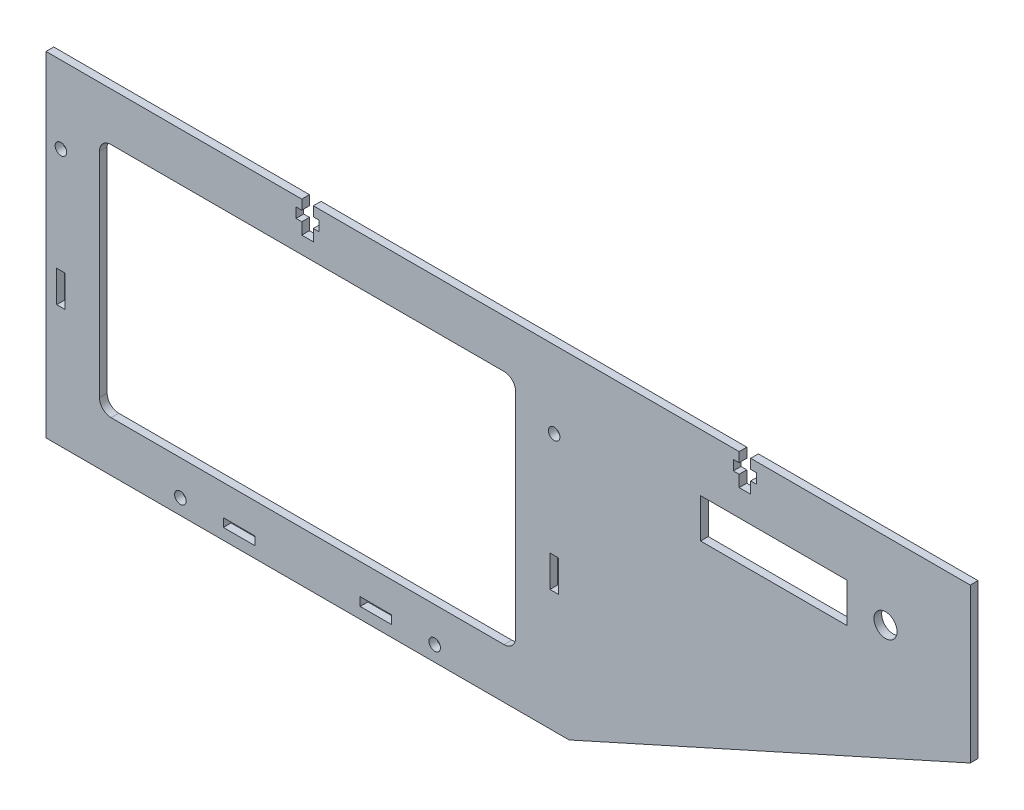
from build123d import *

# Parameters (mm, degrees)
SKETCH_1_R      = 1.5
SKETCH_1_R_2    = 3
SKETCH_1_W      = 8.2
SKETCH_1_H      = 2.2
SKETCH_1_W_2    = 2.2
SKETCH_1_H_2    = 8.2
EXTRUDE_1_DEPTH = 2


with BuildPart() as part:
    # 草图1 → 凸台-拉伸1 (new body)
    with BuildSketch(Plane.XY):
        Polygon((-52.184883937, -13.095981945), (-18.934883937, -13.095981945), (18.565116063, -13.095981945), (67.695116063, -13.095981945), (171.815116063, 33.779018055), (171.815116063, 73.779018055), (114.815116063, 73.779018055), (114.815116063, 71.279018055), (116.315116063, 71.279018055), (116.315116063, 68.679018055), (114.815116063, 68.679018055), (114.815116063, 65.679018055), (111.815116063, 65.679018055), (111.815116063, 68.679018055), (110.315116063, 68.679018055), (110.315116063, 71.279018055), (111.815116063, 71.279018055), (111.815116063, 73.779018055), (1.315116063, 73.779018055), (1.315116063, 71.279018055), (2.815116063, 71.279018055), (2.815116063, 68.679018055), (1.315116063, 68.679018055), (1.315116063, 65.679018055), (-1.684883937, 65.679018055), (-1.684883937, 68.679018055), (-3.184883937, 68.679018055), (-3.184883937, 71.279018055), (-1.684883937, 71.279018055), (-1.684883937, 73.779018055), (-68.061769393, 73.779018055), (-68.061769393, -13.095981945), align=None)
        with Locations((-33.184883937, -9.095981945)):
            Circle(SKETCH_1_R, mode=Mode.SUBTRACT)
        with Locations((32.815116063, -9.095981945)):
            Circle(SKETCH_1_R, mode=Mode.SUBTRACT)
        with Locations((149.815116063, 53.779018055)):
            Circle(SKETCH_1_R_2, mode=Mode.SUBTRACT)
        with Locations((-64.184883937, 53.779018055)):
            Circle(SKETCH_1_R, mode=Mode.SUBTRACT)
        with Locations((63.815116063, 53.779018055)):
            Circle(SKETCH_1_R, mode=Mode.SUBTRACT)
        with Locations((-17.934883937, -9.095981946)):
            Rectangle(SKETCH_1_W, SKETCH_1_H, mode=Mode.SUBTRACT)
        with Locations((63.815116063, 22.341518055)):
            Rectangle(SKETCH_1_W_2, SKETCH_1_H_2, mode=Mode.SUBTRACT)
        with Locations((17.565116063, -9.095981946)):
            Rectangle(SKETCH_1_W, SKETCH_1_H, mode=Mode.SUBTRACT)
        with Locations((-64.184883937, 22.341518055)):
            Rectangle(SKETCH_1_W_2, SKETCH_1_H_2, mode=Mode.SUBTRACT)
        Polygon((124.815116063, 48.679018055), (139.815116063, 48.679018055), (139.815116063, 58.879018055), (124.815116063, 58.879018055), (101.815116063, 58.879018055), (101.815116063, 48.679018055), align=None, mode=Mode.SUBTRACT)
        with BuildLine():
            Line((53.815116063, 58.279018055), (53.815116063, 2.904018055))
            ThreePointArc((53.815116063, 2.904018055), (52.936436406, 0.782697711), (50.815116063, -0.095981945))
            Line((50.815116063, -0.095981945), (-51.184883937, -0.095981945))
            ThreePointArc((-51.184883937, -0.095981945), (-53.306204281, 0.782697711), (-54.184883937, 2.904018055))
            Line((-54.184883937, 2.904018055), (-54.184883937, 58.279018055))
            ThreePointArc((-54.184883937, 58.279018055), (-53.306204281, 60.400338398), (-51.184883937, 61.279018055))
            Line((-51.184883937, 61.279018055), (50.815116063, 61.279018055))
            ThreePointArc((50.815116063, 61.279018055), (52.936436406, 60.400338398), (53.815116063, 58.279018055))
        make_face(mode=Mode.SUBTRACT)
    extrude(amount=EXTRUDE_1_DEPTH)


solid = part.part
